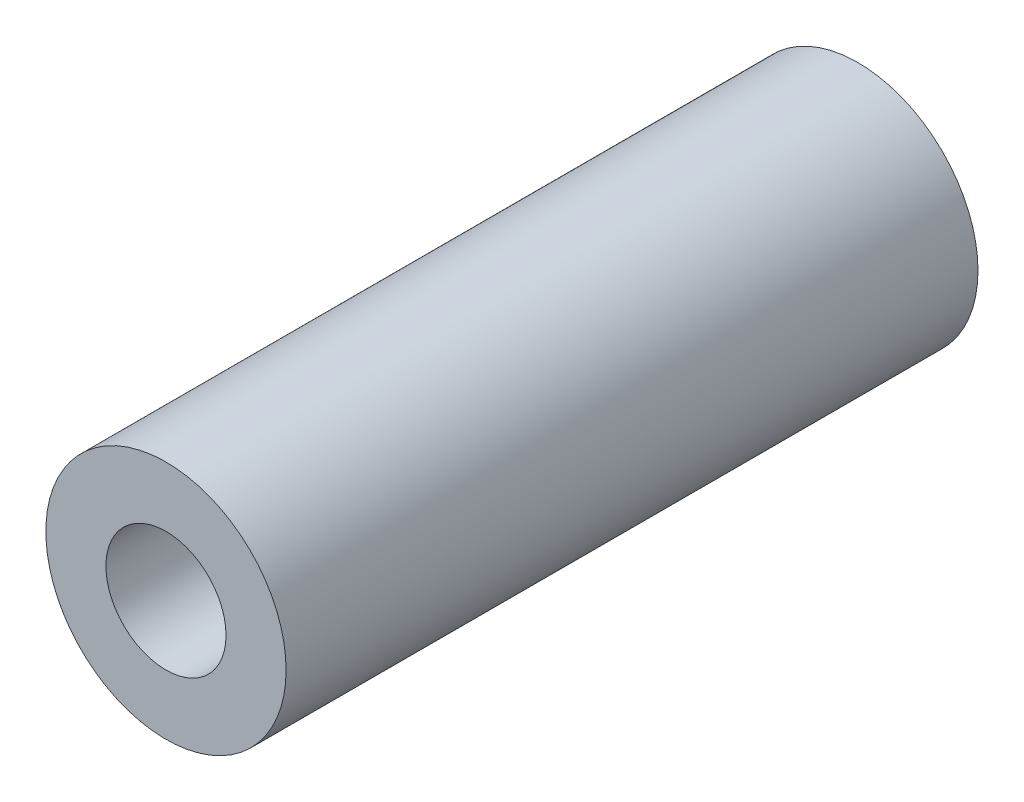
from build123d import *

# Parameters (mm, degrees)
SKETCH1_R           = 3.175
SKETCH1_R_2         = 1.5875
BOSS_EXTRUDE2_DEPTH = 18.288


with BuildPart() as part:
    # Sketch1 → Boss-Extrude2 (new body)
    with BuildSketch(Plane.XY):
        Circle(SKETCH1_R)
        Circle(SKETCH1_R_2, mode=Mode.SUBTRACT)
    extrude(amount=BOSS_EXTRUDE2_DEPTH)


solid = part.part
